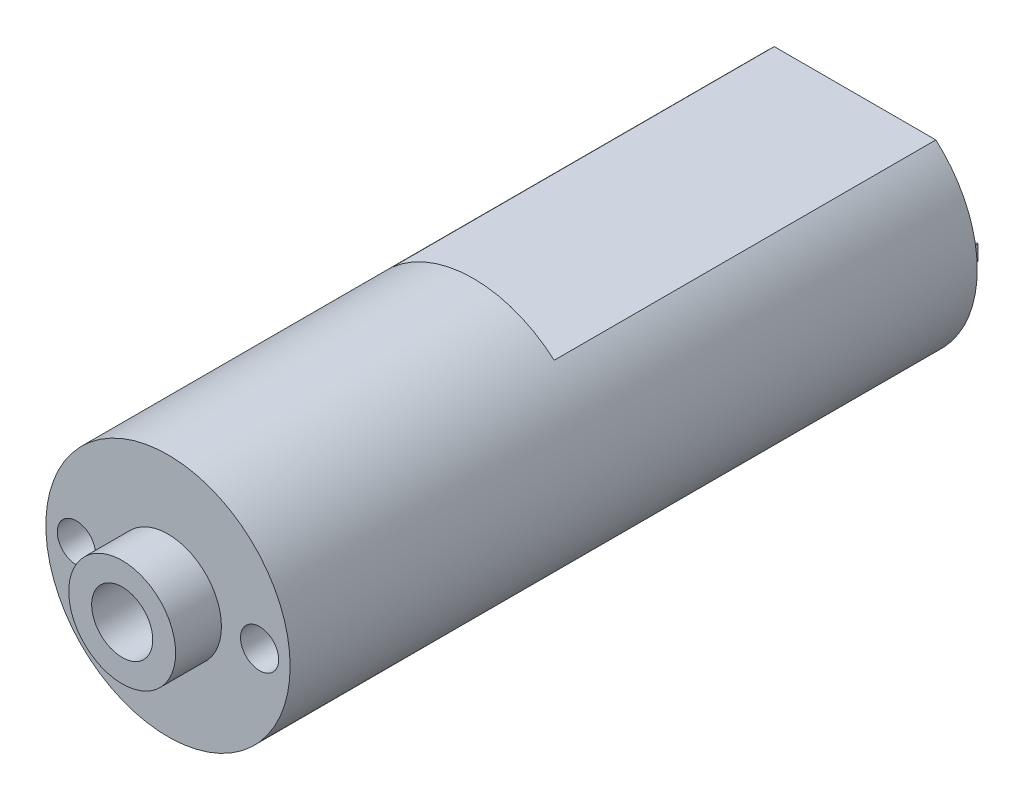
from build123d import *
from build123d.topology import SkipClean

# Parameters (mm, degrees)
SKETCH1_R           = 8
SKETCH1_R_2         = 2
SKETCH1_R_3         = 1.25
BOSS_EXTRUDE1_DEPTH = 20
BOSS_EXTRUDE2_START = 3
BOSS_EXTRUDE2_DEPTH = 3
BOSS_EXTRUDE3_DEPTH = 25
SKETCH3_R           = 2
SKETCH3_W           = 0.1
SKETCH3_H           = 1
BOSS_EXTRUDE5_DEPTH = 1
FILLET2_R           = 1


with BuildPart() as part:
    # Sketch1 → Boss-Extrude1 (new body)
    with BuildSketch(Plane.XY):
        Circle(SKETCH1_R)
        Circle(SKETCH1_R_2, mode=Mode.SUBTRACT)
        with Locations((-6, 0)):
            Circle(SKETCH1_R_3, mode=Mode.SUBTRACT)
        with Locations((6, 0)):
            Circle(SKETCH1_R_3, mode=Mode.SUBTRACT)
    extrude(amount=-BOSS_EXTRUDE1_DEPTH)

    # Sketch1<3> → Boss-Extrude2 (add)
    with SkipClean():  # the faces are left unmerged after this step: merging them gives an invalid solid
        with BuildSketch(Plane.XY.offset(BOSS_EXTRUDE2_START)):
            with BuildLine():
                ThreePointArc((-2, 0), (0, 2), (2, 0))
                Line((2, 0), (3.5, 0))
                ThreePointArc((3.5, 0), (0, 3.5), (-3.5, 0))
                Line((-3.5, 0), (-2, 0))
            make_face()
            with BuildLine():
                Line((3.5, 0), (2, 0))
                ThreePointArc((2, 0), (0, -2), (-2, 0))
                Line((-2, 0), (-3.5, 0))
                ThreePointArc((-3.5, 0), (0, -3.5), (3.5, 0))
            make_face()
        extrude(amount=-BOSS_EXTRUDE2_DEPTH)

    # Sketch2 → Boss-Extrude3 (add)
    with SkipClean():  # the faces are left unmerged after this step: merging them gives an invalid solid
        with BuildSketch(Plane(origin=(0, 0, -20), x_dir=(-1, 0, 0), z_dir=(0, 0, -1))):
            with BuildLine():
                Line((-5.291502622, 6), (5.291502622, 6))
                ThreePointArc((5.291502622, 6), (8, 0), (5.291502622, -6))
                Line((5.291502622, -6), (-5.291502622, -6))
                ThreePointArc((-5.291502622, -6), (-8, 0), (-5.291502622, 6))
            make_face()
        extrude(amount=BOSS_EXTRUDE3_DEPTH)

    # Sketch3 → Boss-Extrude5 (add)
    with SkipClean():  # the faces are left unmerged after this step: merging them gives an invalid solid
        with BuildSketch(Plane(origin=(0, 0, -45), x_dir=(-1, 0, 0), z_dir=(0, 0, -1))):
            with Locations(Location((0, 0, 0), (0, 0, 180))):
                Circle(SKETCH3_R)
            with Locations((7, 0)):
                Rectangle(SKETCH3_W, SKETCH3_H)
            with Locations((-7, 0)):
                Rectangle(SKETCH3_W, SKETCH3_H)
        extrude(amount=BOSS_EXTRUDE5_DEPTH)

    # Fillet2
    fillet2_edges = [part.edges().sort_by_distance(p)[0] for p in [
        (-2, 0, -46),
    ]]
    fillet(fillet2_edges, radius=FILLET2_R - 0.0001)  # a hair under: the kernel refuses the full size


solid = part.part
